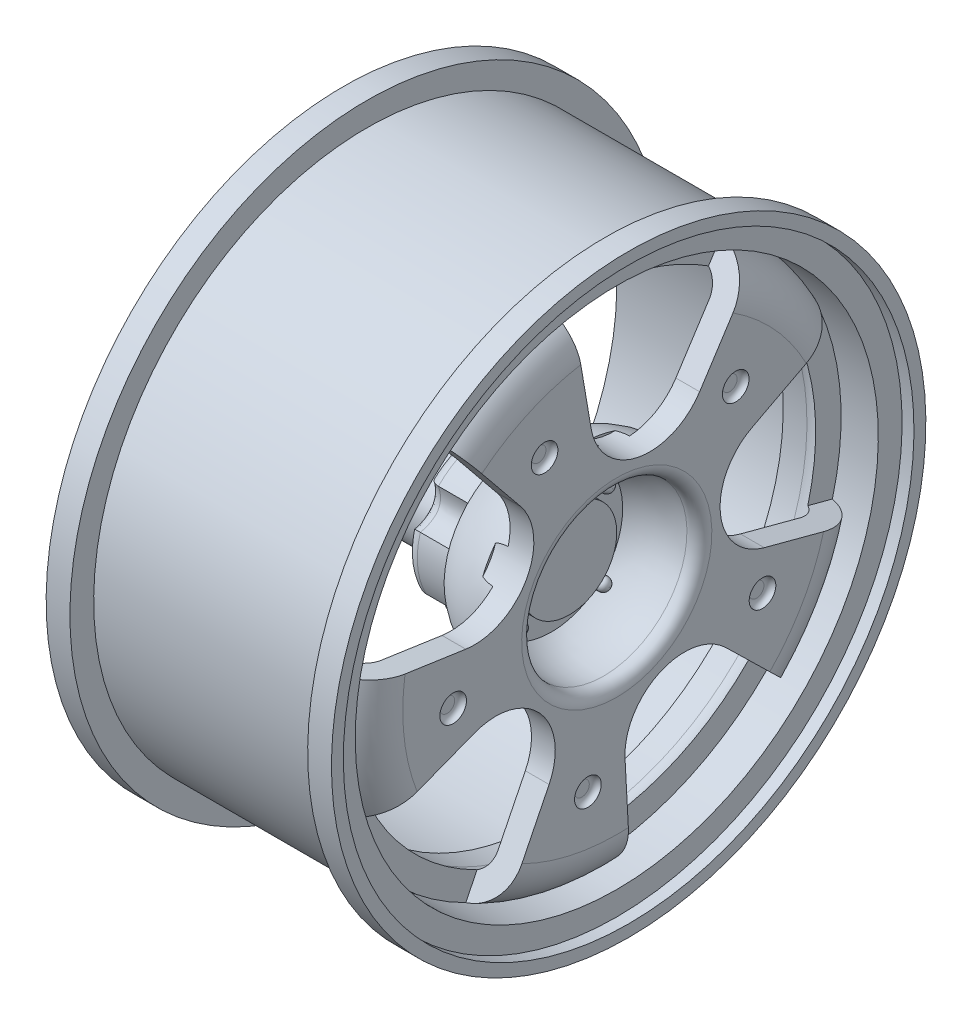
from build123d import *

# Parameters (mm, degrees)
CUT_EXTRUDE3_START       = -3
CUT_EXTRUDE3_DEPTH       = 3
CIRPATTERN1_COUNT        = 5
SKETCH3_R                = 0.525661237
BOSS_EXTRUDE1_DEPTH      = 1.5
FILLET1_R                = 0.5
CIRPATTERN3_COUNT        = 4
FILLET1_OF_CIRPATTERN3_R = 0.5
SKETCH4_R                = 1.119692218
CUT_EXTRUDE4_DEPTH       = 0.5
FILLET3_R                = 0.5
CIRPATTERN4_COUNT        = 5
FILLET3_OF_CIRPATTERN4_R = 0.5
SKETCH6_R                = 6.280504201
BOSS_EXTRUDE2_DEPTH      = 4
CUT_EXTRUDE6_START       = -4
CUT_EXTRUDE6_DEPTH       = 4
CIRPATTERN5_COUNT        = 5
FILLET4_R                = 1
SKETCH9_R                = 3.972007281
BOSS_EXTRUDE3_DEPTH      = 15
CUT_EXTRUDE7_DEPTH       = 15
SKETCH11_R               = 2.972007281
CUT_EXTRUDE8_DEPTH       = 0.5
FILLET6_R                = 0.5


# Some blends are built 0.0001 mm under size
with BuildPart() as part:
    # Sketch1 → Revolve2 (revolve)
    with BuildSketch(Plane.XY, mode=Mode.PRIVATE) as revolve2_sk:
        with BuildLine():
            Line((11, -1), (7, -1))
            ThreePointArc((7, -1), (9.828427125, -2.171572875), (11, -5))
            Line((11, -5), (11, -15))
            ThreePointArc((11, -15), (10.669678617, -15.742651028), (9.896938901, -15.994675027))
            ThreePointArc((9.896938901, -15.994675027), (7.615279838, -16.133495319), (5.5, -17))
            Line((5.5, -17), (5.5, -19))
            Line((5.5, -19), (7, -19))
            Line((7, -19), (7, -23))
            Line((7, -23), (3.5, -23))
            Line((3.5, -23), (3.5, -15.972518506))
            ThreePointArc((3.5, -15.972518506), (6.081635395, -14.505895473), (9, -13.959111724))
            Line((9, -13.959111724), (9, -5))
            ThreePointArc((9, -5), (8.414213562, -3.585786438), (7, -3))
            Line((7, -3), (5, -3))
            Line((5, -3), (5, -1))
            Line((5, -1), (-11, -1))
            Line((-11, -1), (-11, 1))
            Line((-11, 1), (-12, 1))
            Line((-12, 1), (-12, 2))
            Line((-12, 2), (-10, 2))
            Line((-10, 2), (-10, 0))
            Line((-10, 0), (10, 0))
            Line((10, 0), (10, 2))
            Line((10, 2), (12, 2))
            Line((12, 2), (12, 1))
            Line((12, 1), (11, 1))
            Line((11, 1), (11, -1))
        make_face()
    revolve(revolve2_sk.sketch.rotate(Axis((-26.598301302, -23, 0), (1, 0, 0)), 180), axis=Axis((-26.598301302, -23, 0), (1, 0, 0)))

    # Sketch2 → Cut-Extrude3 (cut)
    with BuildSketch(Plane(origin=(11, 0, 0), x_dir=(0, 0, -1), z_dir=(1, 0, 0)).offset(CUT_EXTRUDE3_START)):
        with BuildLine():
            Line((19.483463275, -12.782629555), (11.366341309, -17.039349261))
            ThreePointArc((11.366341309, -17.039349261), (8.719518182, -22.023743829), (12.403113434, -26.299371021))
            Line((12.403113434, -26.299371021), (21.260632468, -28.655573097))
            ThreePointArc((21.260632468, -28.655573097), (21.863392204, -20.552127179), (19.483463275, -12.782629555))
        make_face()
    cut_extrude3 = extrude(amount=CUT_EXTRUDE3_DEPTH, mode=Mode.SUBTRACT)

    # CirPattern1: Cut-Extrude3 ×5 about axis
    cirpattern1_axis = Axis((0, -23, 0), (1, 0, 0))
    for i in range(1, CIRPATTERN1_COUNT):
        add(cut_extrude3.rotate(cirpattern1_axis, i * 360 / CIRPATTERN1_COUNT), mode=Mode.SUBTRACT)

    # Sketch3 → Boss-Extrude1 (add)
    with BuildSketch(Plane(origin=(5.5, 0, 0), x_dir=(0, 0, -1), z_dir=(1, 0, 0))):
        with Locations(Location((3.661454995, -19.637776227, 0), (0, 0, 270))):
            Circle(SKETCH3_R)
    boss_extrude1 = extrude(amount=BOSS_EXTRUDE1_DEPTH)

    # Fillet1
    fillet1_edges = [part.edges().sort_by_distance(p)[0] for p in [
        (7, -19.11211499, -3.661454995),
    ]]
    fillet(fillet1_edges, radius=FILLET1_R)

    # CirPattern3: Boss-Extrude1 ×4 about axis
    cirpattern3_axis = Axis((0, -23, 0), (1, 0, 0))
    for i in range(1, CIRPATTERN3_COUNT):
        add(boss_extrude1.rotate(cirpattern3_axis, i * 360 / CIRPATTERN3_COUNT))

    # Fillet1 of CirPattern3
    fillet1_of_cirpattern3_edges = [part.edges().sort_by_distance(p)[0] for p in [
        (7, -19.338545005, 3.88788501),
        (7, -26.88788501, 3.661454995),
        (7, -26.661454995, -3.88788501),
    ]]
    fillet(fillet1_of_cirpattern3_edges, radius=FILLET1_OF_CIRPATTERN3_R)

    # Sketch4 → Cut-Extrude4 (cut)
    with BuildSketch(Plane(origin=(11, 0, 0), x_dir=(0, 0, -1), z_dir=(1, 0, 0))):
        with Locations(Location((10.006519434, -13.362141808, 0), (0, 0, 90))):
            Circle(SKETCH4_R)
    cut_extrude4 = extrude(amount=-CUT_EXTRUDE4_DEPTH, mode=Mode.SUBTRACT)

    # Fillet3
    fillet3_edges = [part.edges().sort_by_distance(p)[0] for p in [
        (10.5, -14.481834026, -10.006519434),
    ]]
    fillet(fillet3_edges, radius=FILLET3_R - 0.0001)  # a hair under: the kernel refuses the full size

    # CirPattern4: Cut-Extrude4 ×5 about axis
    cirpattern4_axis = Axis((0, -23, 0), (1, 0, 0))
    for i in range(1, CIRPATTERN4_COUNT):
        add(cut_extrude4.rotate(cirpattern4_axis, i * 360 / CIRPATTERN4_COUNT), mode=Mode.SUBTRACT)

    # Fillet3 of CirPattern4
    fillet3_of_cirpattern4_edges = [part.edges().sort_by_distance(p)[0] for p in [
        (10.5, -10.85097644, 5.009072697),
        (10.5, -24.009656484, 13.102296613),
        (10.5, -35.773025584, 3.08859194),
        (10.5, -29.884507466, -11.193441817),
    ]]
    fillet(fillet3_of_cirpattern4_edges, radius=FILLET3_OF_CIRPATTERN4_R - 0.0001)  # a hair under: the kernel refuses the full size

    # Sketch6 → Boss-Extrude2 (add)
    with BuildSketch(Plane.ZY.offset(-3.5)):
        with Locations(Location((0, -23, 0), (0, 0, 90))):
            Circle(SKETCH6_R)
    extrude(amount=BOSS_EXTRUDE2_DEPTH)

    # Sketch8 → Cut-Extrude6 (cut)
    with BuildSketch(Plane.ZY.offset(0.5).offset(CUT_EXTRUDE6_START)):
        with BuildLine():
            ThreePointArc((-2.775391482, -17.366001852), (-1.343692835, -16.864918698), (0.166384576, -16.721700135))
            add(Edge.make_bspline(
                [(0.166384576, -16.721700135), (-1.000353055, -18.700654058), (-2.775391482, -17.366001852)],
                knots=[0, 0, 0, 1, 1, 1], degree=2))
        make_face()
    cut_extrude6 = extrude(amount=CUT_EXTRUDE6_DEPTH, mode=Mode.SUBTRACT)

    # CirPattern5: Cut-Extrude6 ×5 about axis
    cirpattern5_axis = Axis((-0.5, -23, 0), (-1, 0, 0))
    for i in range(1, CIRPATTERN5_COUNT):
        add(cut_extrude6.rotate(cirpattern5_axis, i * 360 / CIRPATTERN5_COUNT), mode=Mode.SUBTRACT)

    # Fillet4
    fillet4_edges = [part.edges().sort_by_distance(p)[0] for p in [
        (-0.5, -18.826417797, -4.69318065),
        (-0.5, -17.867147264, -1.130033398),
        (-0.5, -26.173772211, -5.419585129),
        (-0.5, -22.488586902, -5.230832566),
        (-0.5, -29.135081302, 1.343692835),
        (-0.5, -23.617916558, 6.250032971),
        (-0.5, -17.246812133, 2.519039972),
        (-0.5, -27.816782059, -2.102798917),
        (-0.5, -26.488348127, 3.931231363),
        (-0.5, -20.339135648, 4.532433517),
    ]]
    fillet(fillet4_edges, radius=FILLET4_R)

    # Sketch9 → Boss-Extrude3 (add)
    with BuildSketch(Plane.ZY.offset(0.5)):
        with Locations(Location((0, -23, 0), (0, 0, 270))):
            Circle(SKETCH9_R)
    extrude(amount=BOSS_EXTRUDE3_DEPTH)

    # Sketch10 → Cut-Extrude7 (cut)
    with BuildSketch(Plane.ZY.offset(15.5)):
        with BuildLine():
            Line((2.198369231, -21), (-2.198369231, -21))
            ThreePointArc((-2.198369231, -21), (-2.972007281, -23), (-2.198369231, -25))
            Line((-2.198369231, -25), (2.198369231, -25))
            ThreePointArc((2.198369231, -25), (2.972007281, -23), (2.198369231, -21))
        make_face()
    extrude(amount=-CUT_EXTRUDE7_DEPTH, mode=Mode.SUBTRACT)

    # Sketch11 → Cut-Extrude8 (cut)
    with BuildSketch(Plane.ZY.offset(15.5)):
        with Locations(Location((0, -23, 0), (0, 0, 270))):
            Circle(SKETCH11_R)
    extrude(amount=-CUT_EXTRUDE8_DEPTH, mode=Mode.SUBTRACT)

    # Fillet6
    # the kernel refuses this fillet: 0.5 mm, written as the material it takes off along each edge
    with BuildSketch(Plane(origin=(-15, -25, 3.448369231), x_dir=(1, 0, 0), z_dir=(0, 0, -1))) as fillet6_piece_1_section:
        with BuildLine():
            CenterArc((FILLET6_R, FILLET6_R), FILLET6_R, 180, 90)
            Line((0, FILLET6_R), (0, 0))
            Line((0, 0), (FILLET6_R, 0))
        make_face()
    fillet6_piece_1 = extrude(amount=6.896738463, mode=Mode.PRIVATE)
    fillet6_piece_1 = fillet6_piece_1 & Plane(origin=(-14.883332413, -23, 0), x_dir=(0, -1, 0), z_dir=(-1, 0, 0)) * Cylinder(2.972007281, 16, mode=Mode.PRIVATE)
    add(fillet6_piece_1, mode=Mode.SUBTRACT)
    with BuildSketch(Plane(origin=(-15, -21, -3.448369231), x_dir=(1, 0, 0), z_dir=(0, 0, 1))) as fillet6_piece_2_section:
        with BuildLine():
            CenterArc((FILLET6_R, FILLET6_R), FILLET6_R, 180, 90)
            Line((0, FILLET6_R), (0, 0))
            Line((0, 0), (FILLET6_R, 0))
        make_face()
    fillet6_piece_2 = extrude(amount=6.896738463, mode=Mode.PRIVATE)
    fillet6_piece_2 = fillet6_piece_2 & Plane(origin=(-14.883332413, -23, 0), x_dir=(0, -1, 0), z_dir=(-1, 0, 0)) * Cylinder(2.972007281, 16, mode=Mode.PRIVATE)
    add(fillet6_piece_2, mode=Mode.SUBTRACT)


solid = part.part
